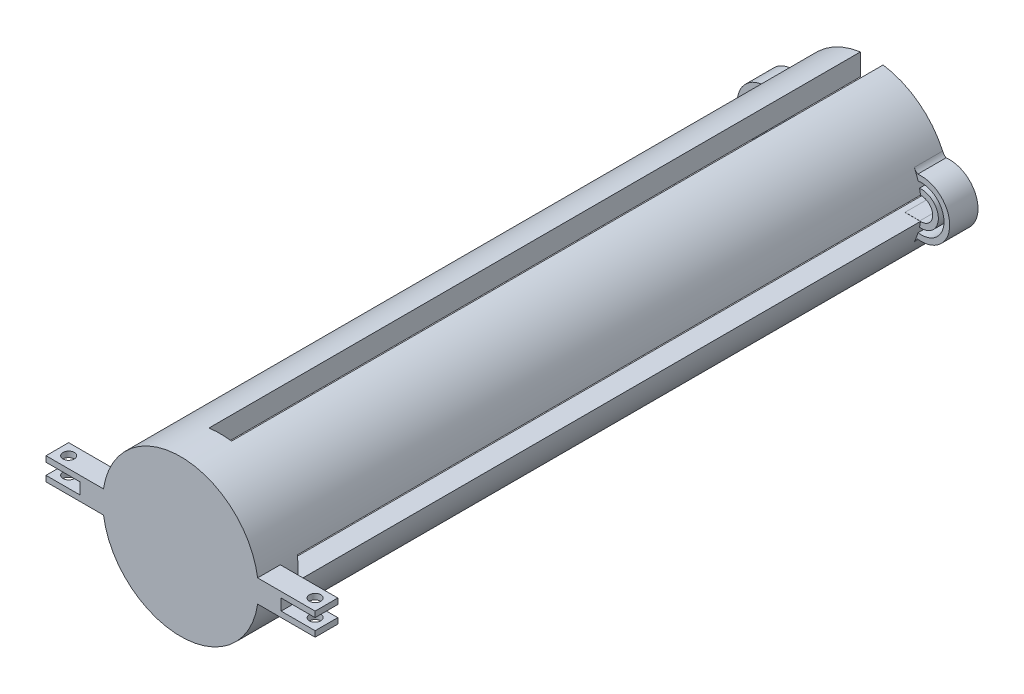
from build123d import *

# Parameters (mm, degrees)
SKETCH1_R               = 17.4625
SKETCH1_R_2             = 12.7
EXTRUDE_THIN1_DEPTH     = 152.4
CUT_EXTRUDE1_DEPTH      = 25.4
CUT_EXTRUDE1_DEPTH_BACK = 139.7
EXTRUDE_THIN2_DEPTH     = 6.35
SKETCH4_R               = 17.4625
BOSS_EXTRUDE1_DEPTH     = 2.54
FILLET1_R               = 2.54
BOSS_EXTRUDE2_START     = -0.185715
SKETCH5_W               = 5.08
SKETCH5_H               = 5.08
BOSS_EXTRUDE2_DEPTH     = 12.885715
CUT_EXTRUDE2_REACH      = 160.812
SKETCH6_W               = 7.62
SKETCH6_H               = 2.54
SKETCH7_R               = 1.27
CUT_EXTRUDE3_DEPTH      = 160.110904757


# Read off the part's stored shape, not the designer's step: Extrude-Thin2
with BuildPart() as part:
    # Sketch1 → Extrude-Thin1 (new body)
    with BuildSketch(Plane.XY):
        Circle(SKETCH1_R)
        Circle(SKETCH1_R_2, mode=Mode.SUBTRACT)
    extrude(amount=EXTRUDE_THIN1_DEPTH)

    # Sketch2 → Cut-Extrude1 (cut, two sides: drawn at the far end of the back side and taken through both)
    with BuildSketch(Plane(origin=(0, 0, 6.35), x_dir=(-1, 0, 0), z_dir=(0, 0, -1)).offset(-CUT_EXTRUDE1_DEPTH_BACK)):
        Polygon((-2.54, 2.54), (-31.75, 2.54), (-31.75, -2.54), (-2.54, -2.54), (-2.54, -31.75), (2.54, -31.75), (2.54, -2.54), (31.75, -2.54), (31.75, 2.54), (2.54, 2.54), (2.54, 31.75), (-2.54, 31.75), align=None)
    extrude(amount=CUT_EXTRUDE1_DEPTH + CUT_EXTRUDE1_DEPTH_BACK, mode=Mode.SUBTRACT)

    # Extrude-Thin2 outline → Extrude-Thin2 (add)
    with BuildSketch(Plane.XY):
        with BuildLine():
            Line((13.81111464, 2.51726107), (17.123388359, 2.51726107))
            ThreePointArc((17.123388359, 2.51726107), (20.0025, 0), (17.123388359, -2.51726107))
            Line((17.123388359, -2.51726107), (13.81111464, -2.51726107))
            Line((13.81111464, -2.51726107), (13.81111464, -2.54))
            Line((13.81111464, -2.54), (17.276785183, -2.54))
            ThreePointArc((17.276785183, -2.54), (17.17315149, -3.165718582), (17.046863636, -3.78726107))
            ThreePointArc((17.046863636, -3.78726107), (21.2725, 0), (17.046863636, 3.78726107))
            ThreePointArc((17.046863636, 3.78726107), (17.17315149, 3.165718582), (17.276785183, 2.54))
            Line((17.276785183, 2.54), (13.81111464, 2.54))
            Line((13.81111464, 2.54), (13.81111464, 2.51726107))
        make_face()
        with BuildLine():
            ThreePointArc((16.288020729, 6.295973871), (16.518015944, 5.665161561), (16.723590909, 5.025973871))
            ThreePointArc((16.723590909, 5.025973871), (22.5425, 0), (16.723590909, -5.025973871))
            ThreePointArc((16.723590909, -5.025973871), (16.518015944, -5.665161561), (16.288020729, -6.295973871))
            Line((16.288020729, -6.295973871), (16.635932996, -6.295973871))
            ThreePointArc((16.635932996, -6.295973871), (23.8125, 0), (16.635932996, 6.295973871))
            Line((16.635932996, 6.295973871), (16.288020729, 6.295973871))
        make_face()
        with BuildLine():
            ThreePointArc((-16.723590909, 5.025973871), (-16.518015944, 5.665161561), (-16.288020729, 6.295973871))
            Line((-16.288020729, 6.295973871), (-16.635932996, 6.295973871))
            ThreePointArc((-16.635932996, 6.295973871), (-23.8125, 0), (-16.635932996, -6.295973871))
            Line((-16.635932996, -6.295973871), (-16.288020729, -6.295973871))
            ThreePointArc((-16.288020729, -6.295973871), (-16.518015944, -5.665161561), (-16.723590909, -5.025973871))
            ThreePointArc((-16.723590909, -5.025973871), (-22.5425, 0), (-16.723590909, 5.025973871))
        make_face()
        with BuildLine():
            ThreePointArc((-17.276785183, 2.54), (-17.17315149, 3.165718582), (-17.046863636, 3.78726107))
            ThreePointArc((-17.046863636, 3.78726107), (-21.2725, 0), (-17.046863636, -3.78726107))
            ThreePointArc((-17.046863636, -3.78726107), (-17.17315149, -3.165718582), (-17.276785183, -2.54))
            Line((-17.276785183, -2.54), (-14.302412139, -2.54))
            Line((-14.302412139, -2.54), (-14.302412139, -2.51726107))
            Line((-14.302412139, -2.51726107), (-17.123388359, -2.51726107))
            ThreePointArc((-17.123388359, -2.51726107), (-20.0025, 0), (-17.123388359, 2.51726107))
            Line((-17.123388359, 2.51726107), (-14.302412139, 2.51726107))
            Line((-14.302412139, 2.51726107), (-14.302412139, 2.54))
            Line((-14.302412139, 2.54), (-17.276785183, 2.54))
        make_face()
    extrude(amount=EXTRUDE_THIN2_DEPTH)

    # Sketch4 → Boss-Extrude1 (add)
    with BuildSketch(Plane.XY.offset(152.4)):
        with Locations(Location((0, 0, 0), (0, 0, 171.636398211))):
            Circle(SKETCH4_R)
    extrude(amount=BOSS_EXTRUDE1_DEPTH)

    # Fillet1
    # the kernel refuses this fillet: 2.54 mm, written as the material it adds along each edge
    with BuildSketch(Plane(origin=(-16.288020729, -6.295973871, 0), x_dir=(0.3878333084832039, -0.9217295291087142, 0), z_dir=(0, 0, 1)), Plane(origin=(16.288020729, 6.295973871, 0), x_dir=(-0.38783330848320335, 0.9217295291087143, 0), z_dir=(0, 0, 1))) as fillet1_piece_1:
        with BuildLine():
            CenterArc((1.10244597, -2.53890008), FILLET1_R, 91.686230358, 27.467637925)
            Line((-0.134931966, -0.32068101), (-0.159679524, -0.276316629))
            ThreePointArc((-0.159679524, -0.276316629), (-0.114289843, -0.140638573), (-0.04682386, 0.019701932))
            Line((-0.04682386, 0.019701932), (0.001494842, 0.050778002))
            ThreePointArc((0.001494842, 0.050778002), (0.513851935, 0.043238053), (1.026209029, 0.050778002))
            Line((1.026209029, 0.050778002), (1.027703871, 0))
        make_face()
    extrude(amount=6.35)
    with BuildSketch(Plane(origin=(-16.288020729, 6.295973871, 0), x_dir=(0.38783330848320663, 0.9217295291087131, 0), z_dir=(0, 0, 1)), Plane(origin=(16.288020729, -6.295973871, 0), x_dir=(-0.3878333084832061, -0.9217295291087134, 0), z_dir=(0, 0, 1))) as fillet1_piece_2:
        with BuildLine():
            CenterArc((1.10244597, 2.53890008), FILLET1_R, 240.846131717, 27.467637925)
            Line((-0.134931966, 0.32068101), (-0.159679524, 0.276316629))
            ThreePointArc((-0.159679524, 0.276316629), (-0.114289843, 0.140638573), (-0.04682386, -0.019701932))
            Line((-0.04682386, -0.019701932), (0.001494842, -0.050778002))
            ThreePointArc((0.001494842, -0.050778002), (0.513851935, -0.043238053), (1.026209029, -0.050778002))
            Line((1.026209029, -0.050778002), (1.027703871, 0))
        make_face()
    extrude(amount=6.35)

    # Sketch5 → Boss-Extrude2 (add)
    with BuildSketch(Plane(origin=(17.4625, 0, 146.05), x_dir=(0, 0, -1), z_dir=(1, 0, 0)).offset(BOSS_EXTRUDE2_START)):
        with Locations((-6.35, 0)):
            Rectangle(SKETCH5_W, SKETCH5_H)
    boss_extrude2 = extrude(amount=BOSS_EXTRUDE2_DEPTH)

    # Sketch6 → Cut-Extrude2 (cut, up to next)
    with BuildSketch(Plane.XY.offset(154.94), mode=Mode.PRIVATE) as cut_extrude2_sk1:
        with Locations((26.3525, 0)):
            Rectangle(SKETCH6_W, SKETCH6_H)
    cut_extrude2_tool1 = extrude(cut_extrude2_sk1.sketch, amount=-CUT_EXTRUDE2_REACH, mode=Mode.PRIVATE) & part.part
    cut_extrude2 = cut_extrude2_tool1.solids().sort_by_distance((26.3525, 0, 154.94))[0]
    add(cut_extrude2, mode=Mode.SUBTRACT)

    # Sketch7 → Cut-Extrude3 (cut, through all)
    with BuildSketch(Plane.XZ.offset(2.54)):
        with Locations((27.6225, 152.4)):
            Circle(SKETCH7_R)
    cut_extrude3 = extrude(amount=-CUT_EXTRUDE3_DEPTH, mode=Mode.SUBTRACT)

    # Mirror2: Boss-Extrude2, Cut-Extrude2, Cut-Extrude3 across plane
    add(boss_extrude2.mirror(Plane(origin=(0, 0, 0), x_dir=(0, 0, 1), z_dir=(1, 0, 0))))
    add(cut_extrude2.mirror(Plane(origin=(0, 0, 0), x_dir=(0, 0, 1), z_dir=(1, 0, 0))), mode=Mode.SUBTRACT)
    add(cut_extrude3.mirror(Plane(origin=(0, 0, 0), x_dir=(0, 0, 1), z_dir=(1, 0, 0))), mode=Mode.SUBTRACT)


solid = part.part
